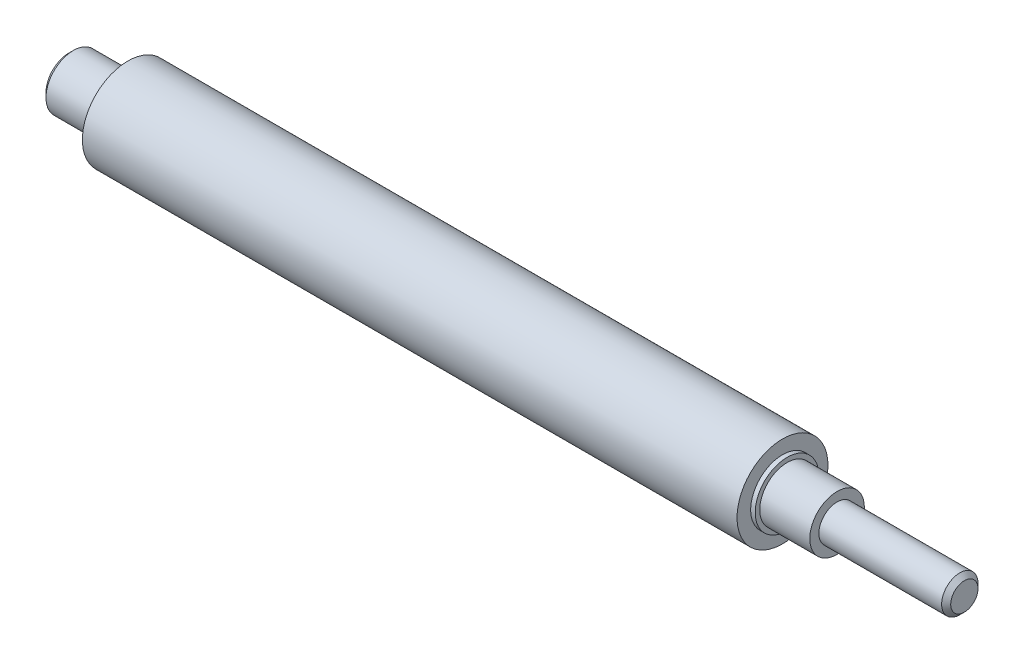
from build123d import *

# Parameters (mm, degrees)
CHAMFER1_SIZE = 0.5


with BuildPart() as part:
    # Sketch1 → Revolve1 (revolve)
    with BuildSketch(Plane.XY):
        Polygon((0, 0), (0, 3), (6, 3), (6, 3.5), (6.5, 3.5), (6.5, 5), (78.5, 5), (78.5, 3.5), (79, 3.5), (79, 3), (84.5, 3), (84.5, 2), (98.5, 2), (98.5, 0), align=None)
    revolve(axis=Axis((98.5, 0, 0), (-1, 0, 0)))

    # Chamfer1
    chamfer1_edges = [part.edges().sort_by_distance(p)[0] for p in [
        (0, -3, 0),
        (98.5, -2, 0),
    ]]
    chamfer(chamfer1_edges, length=CHAMFER1_SIZE)


solid = part.part
